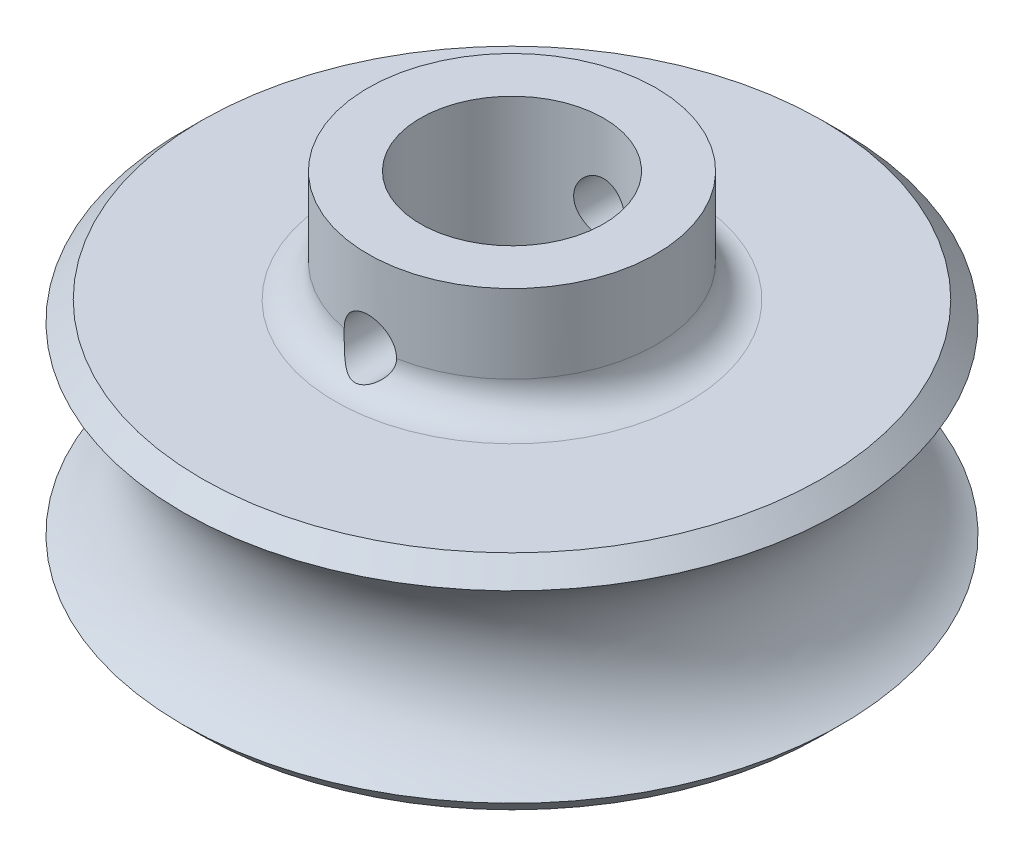
from build123d import *

# Parameters (mm, degrees)
CUT_EXTRUDE1_REACH             = 23.896
SKETCH2_R                      = 1
CUT_EXTRUDE1_DIRECTION_2_REACH = 23.896


with BuildPart() as part:
    # Sketch1 → Revolve1 (revolve)
    with BuildSketch(Plane.XY):
        with BuildLine():
            Line((3.5, 8.5), (3.5, 0))
            Line((3.5, 0), (11.85, 0))
            Line((11.85, 0), (12.587068007, 0.737068007))
            ThreePointArc((12.587068007, 0.737068007), (10.5, 4.25), (12.587068007, 7.762931993))
            Line((12.587068007, 7.762931993), (11.85, 8.5))
            Line((11.85, 8.5), (6.75, 8.5))
            ThreePointArc((6.75, 8.5), (5.866116524, 8.866116524), (5.5, 9.75))
            Line((5.5, 9.75), (5.5, 12.75))
            Line((5.5, 12.75), (3.5, 12.75))
            Line((3.5, 12.75), (3.5, 8.5))
        make_face()
    revolve(axis=Axis((0, 0, 0), (0, 1, 0)))

    # Sketch2 → Cut-Extrude1 (cut, up to next)
    with BuildSketch(Plane.XY, mode=Mode.PRIVATE) as cut_extrude1_sk1:
        with Locations((0, 9.75)):
            Circle(SKETCH2_R)
    cut_extrude1_tool1 = extrude(cut_extrude1_sk1.sketch, amount=-CUT_EXTRUDE1_REACH, mode=Mode.PRIVATE) & part.part
    add(cut_extrude1_tool1.solids().sort_by_distance((0, 9.75, 0))[0], mode=Mode.SUBTRACT)

    # Sketch2 → Cut-Extrude1 direction 2 (cut, up to next)
    with BuildSketch(Plane.XY, mode=Mode.PRIVATE) as cut_extrude1_direction_2_sk1:
        with Locations((0, 9.75)):
            Circle(SKETCH2_R)
    cut_extrude1_direction_2_tool1 = extrude(cut_extrude1_direction_2_sk1.sketch, amount=CUT_EXTRUDE1_DIRECTION_2_REACH, mode=Mode.PRIVATE) & part.part
    add(cut_extrude1_direction_2_tool1.solids().sort_by_distance((0, 9.75, 0))[0], mode=Mode.SUBTRACT)


solid = part.part
